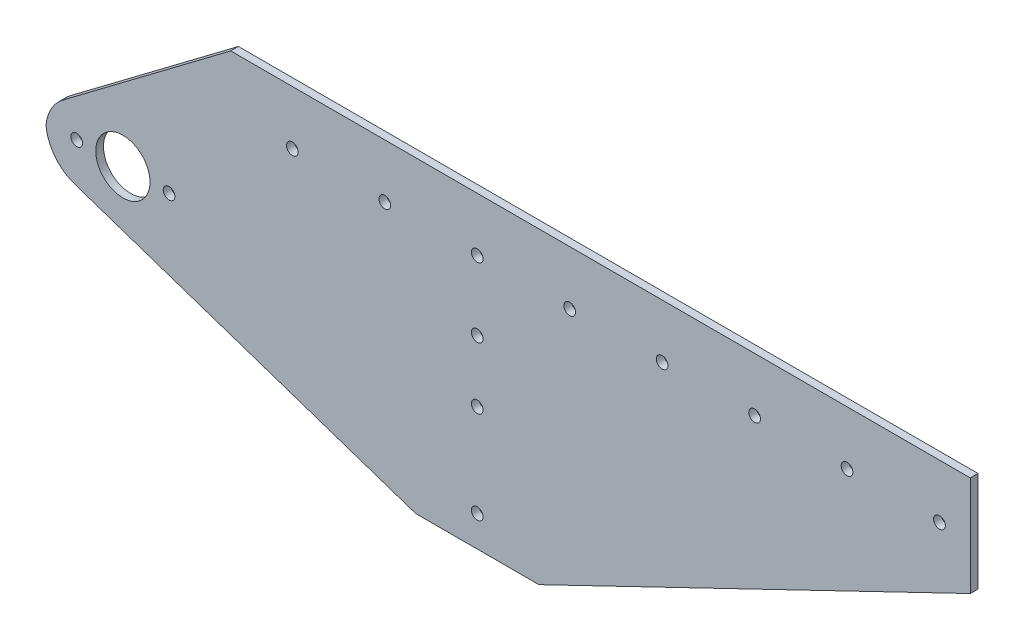
from build123d import *

# Parameters (mm, degrees)
BOSS_EXTRUDE1_DEPTH = 3.175
SKETCH2_R           = 11.176
SKETCH2_R_2         = 2.413
CUT_EXTRUDE1_DEPTH  = 3.175
CHAMFER2_SIZE       = 76.2
CHAMFER2_SIZE2      = 57.420818618
FILLET2_R           = 17.62
SKETCH3_R           = 2.413
CUT_EXTRUDE2_DEPTH  = 3.175


with BuildPart() as part:
    # Sketch1 → Boss-Extrude1 (new body)
    with BuildSketch(Plane.XY):
        Polygon((-304.8, 0), (0, 0), (0, -41.275), (-177.8, -127), (-228.6, -127), (-381, -75.7257486), (-381, 0), align=None)
    extrude(amount=BOSS_EXTRUDE1_DEPTH)

    # Sketch2 → Cut-Extrude1 (cut)
    with BuildSketch(Plane.XY.offset(3.175)):
        with Locations((-349.25, -63.5)):
            Circle(SKETCH2_R)
        with Locations((-279.4, -22.225)):
            Circle(SKETCH2_R_2)
        with Locations((-241.3, -22.225)):
            Circle(SKETCH2_R_2)
        with Locations((-203.2, -22.225)):
            Circle(SKETCH2_R_2)
        with Locations((-203.2, -50.8)):
            Circle(SKETCH2_R_2)
        with Locations((-165.1, -22.225)):
            Circle(SKETCH2_R_2)
        with Locations((-127, -22.225)):
            Circle(SKETCH2_R_2)
        with Locations((-88.9, -22.225)):
            Circle(SKETCH2_R_2)
        with Locations((-12.7, -22.225)):
            Circle(SKETCH2_R_2)
        with Locations((-203.2, -76.2)):
            Circle(SKETCH2_R_2)
        with Locations((-203.2, -114.3)):
            Circle(SKETCH2_R_2)
        with Locations((-50.8, -22.225)):
            Circle(SKETCH2_R_2)
    extrude(amount=-CUT_EXTRUDE1_DEPTH, mode=Mode.SUBTRACT)

    # Chamfer2
    chamfer2_edges = [part.edges().sort_by_distance(p)[0] for p in [
        (-381, 0, 1.5875),
    ]]
    chamfer2_side = [part.faces().sort_by_distance(p)[0] for p in [
        (-190.5, 0, 1.5875),
    ]]
    chamfer(chamfer2_edges, length=CHAMFER2_SIZE, length2=CHAMFER2_SIZE2, reference=chamfer2_side[0])

    # Fillet2
    # the kernel refuses this fillet: 17.62 mm, written as the material it takes off along each edge
    with BuildSketch(Plane(origin=(-381, -75.7257486, -31.65589506), x_dir=(0, 1, 0), z_dir=(0, 0, 1))) as fillet2_piece_1:
        with BuildLine():
            CenterArc((FILLET2_R * 0.718635529169, -FILLET2_R), FILLET2_R, 90, 71.404733131)
            Line((-FILLET2_R * 0.22915922643, -FILLET2_R * 0.681118985733), (0, 0))
            Line((0, 0), (FILLET2_R * 0.718635529169, 0))
        make_face()
    extrude(amount=66.48679012, mode=Mode.SUBTRACT)
    with BuildSketch(Plane(origin=(-381, -57.420818618, -21.962519835), x_dir=(0.7986355100472917, 0.6018150231520498, 0), z_dir=(0, 0, 1))) as fillet2_piece_2:
        with BuildLine():
            CenterArc((FILLET2_R * 0.498581608053, -FILLET2_R), FILLET2_R, 90, 53)
            Line((-FILLET2_R * 0.300053901994, -FILLET2_R * 0.398184976848), (0, 0))
            Line((0, 0), (FILLET2_R * 0.498581608053, 0))
        make_face()
    extrude(amount=47.10003967, mode=Mode.SUBTRACT)

    # Sketch3 → Cut-Extrude2 (cut)
    with BuildSketch(Plane.XY.offset(3.175)):
        with Locations((-368.3, -63.5)):
            Circle(SKETCH3_R)
        with Locations((-330.2, -63.5)):
            Circle(SKETCH3_R)
    extrude(amount=-CUT_EXTRUDE2_DEPTH, mode=Mode.SUBTRACT)


solid = part.part
